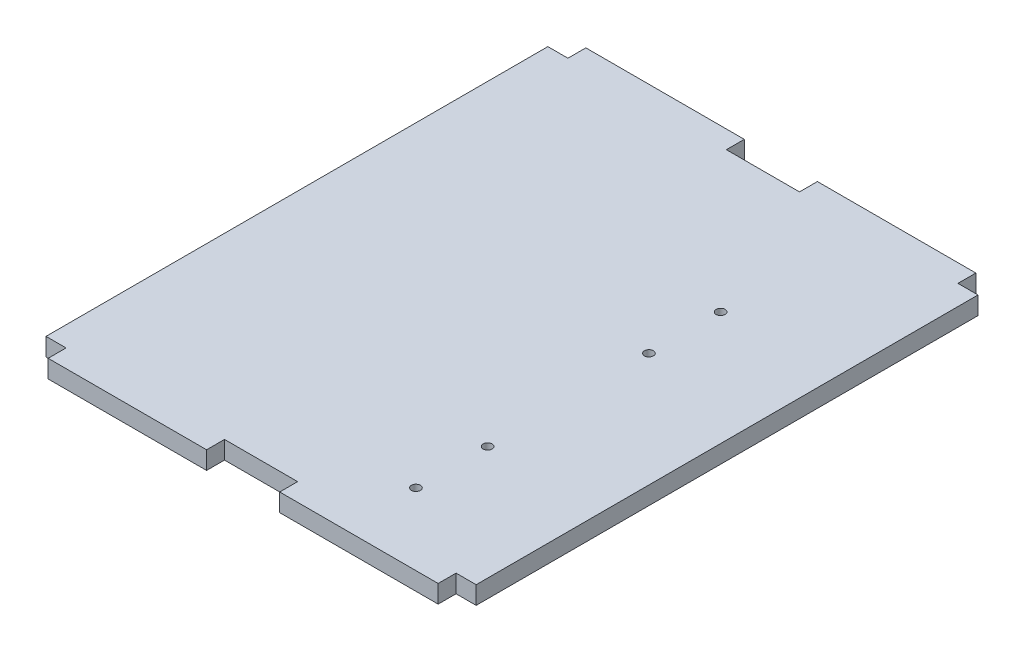
from build123d import *

# Parameters (mm, degrees)
SKETCH1_W           = 304.8
SKETCH1_H           = 355.6
BOSS_EXTRUDE1_DEPTH = 12.7
SKETCH2_R           = 3.175
CUT_EXTRUDE1_DEPTH  = 12.7
SKETCH3_W           = 112.268
SKETCH3_H           = 12.7
BOSS_EXTRUDE2_DEPTH = 12.7


with BuildPart() as part:
    # Sketch1 → Boss-Extrude1 (new body)
    with BuildSketch(Plane(origin=(0, 0, 0), x_dir=(1, 0, 0), z_dir=(0, 1, 0))):
        with Locations((152.4, 177.8)):
            Rectangle(SKETCH1_W, SKETCH1_H)
    extrude(amount=BOSS_EXTRUDE1_DEPTH)

    # Sketch2 → Cut-Extrude1 (cut)
    with BuildSketch(Plane.XZ):
        with Locations((224.028, -38.1)):
            Circle(SKETCH2_R)
        with Locations((224.028, -88.9)):
            Circle(SKETCH2_R)
        with Locations((224.028, -203.2)):
            Circle(SKETCH2_R)
        with Locations((224.028, -254)):
            Circle(SKETCH2_R)
    extrude(amount=-CUT_EXTRUDE1_DEPTH, mode=Mode.SUBTRACT)

    # Sketch3 → Boss-Extrude2 (add)
    with BuildSketch(Plane(origin=(0, 12.7, 0), x_dir=(1, 0, 0), z_dir=(0, 1, 0))):
        with Locations((70.358, 361.95)):
            Rectangle(SKETCH3_W, SKETCH3_H)
        with Locations((234.442, 361.95)):
            Rectangle(SKETCH3_W, SKETCH3_H)
        with Locations((234.442, -6.35)):
            Rectangle(SKETCH3_W, SKETCH3_H)
        with Locations((70.358, -6.35)):
            Rectangle(SKETCH3_W, SKETCH3_H)
    extrude(amount=-BOSS_EXTRUDE2_DEPTH)


solid = part.part
